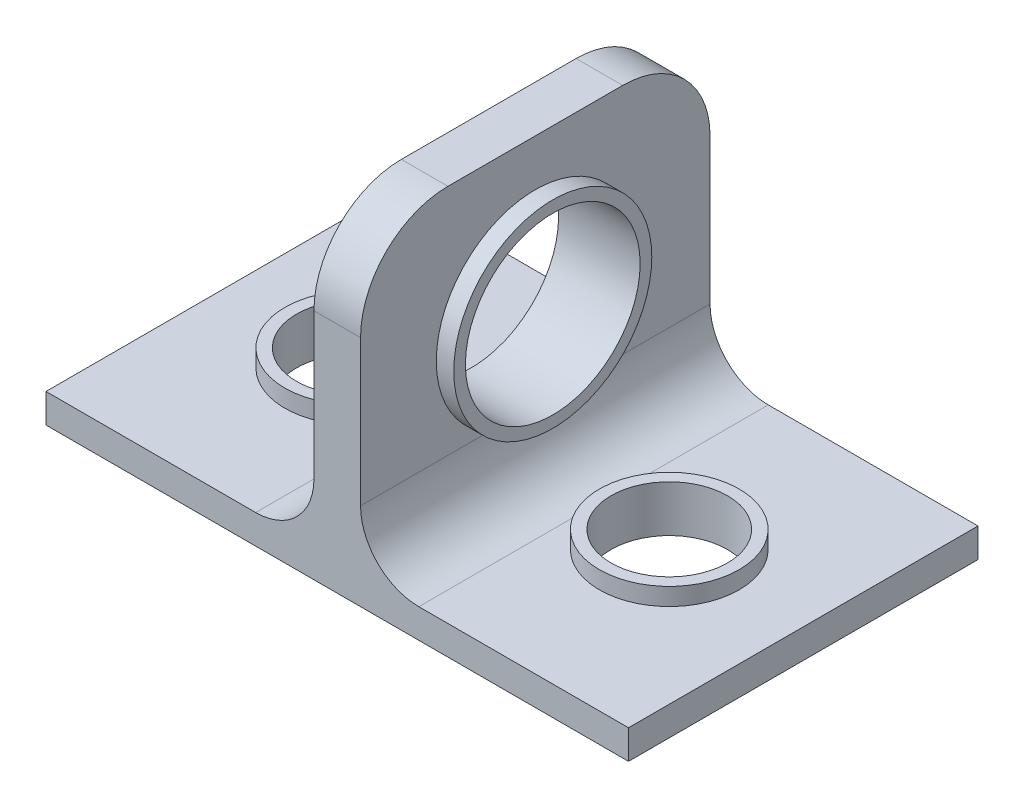
from build123d import *

# Parameters (mm, degrees)
BOSS_EXTRUDE1_DEPTH      = 30
FILLET1_R                = 10
CUT_EXTRUDE1_REACH       = 120.004
SKETCH2_R                = 10
SKETCH2_3_R              = 12
SKETCH2_3_R_2            = 10
BOSS_EXTRUDE2_DEPTH      = 8
CUT_EXTRUDE2_REACH       = 84.71
SKETCH3_R                = 15
BOSS_EXTRUDE3_DEPTH      = 3
BOSS_EXTRUDE3_DEPTH_BACK = 11
SKETCH3_3_R              = 17
SKETCH3_3_R_2            = 15
FILLET2_R                = 15


with BuildPart() as part:
    # Sketch1 → Boss-Extrude1 (new, symmetric)
    with BuildSketch(Plane.XY):
        Polygon((0, 0), (0, 5), (46, 5), (46, 55), (54, 55), (54, 5), (100, 5), (100, 0), align=None)
    extrude(amount=BOSS_EXTRUDE1_DEPTH, both=True)

    # Fillet1
    fillet1_edges = [part.edges().sort_by_distance(p)[0] for p in [
        (46, 5, 0),
        (54, 5, 0),
    ]]
    fillet(fillet1_edges, radius=FILLET1_R)

    # Sketch2 → Cut-Extrude1 (cut, up to next)
    with BuildSketch(Plane(origin=(0, 0, 0), x_dir=(1, 0, 0), z_dir=(0, 1, 0)), mode=Mode.PRIVATE) as cut_extrude1_sk1:
        with Locations((23, 0)):
            Circle(SKETCH2_R)
    cut_extrude1_tool1 = extrude(cut_extrude1_sk1.sketch, amount=CUT_EXTRUDE1_REACH, mode=Mode.PRIVATE) & part.part
    # Sketch2 → Cut-Extrude1 (cut, up to next)
    with BuildSketch(Plane(origin=(0, 0, 0), x_dir=(1, 0, 0), z_dir=(0, 1, 0)), mode=Mode.PRIVATE) as cut_extrude1_sk2:
        with Locations((77, 0)):
            Circle(SKETCH2_R)
    cut_extrude1_tool2 = extrude(cut_extrude1_sk2.sketch, amount=CUT_EXTRUDE1_REACH, mode=Mode.PRIVATE) & part.part
    add(cut_extrude1_tool1.solids().sort_by_distance((23, 0, 0))[0], mode=Mode.SUBTRACT)
    add(cut_extrude1_tool2.solids().sort_by_distance((77, 0, 0))[0], mode=Mode.SUBTRACT)

    # Sketch2<3> → Boss-Extrude2 (add)
    # profile 1 of 2: a face of its own
    with BuildSketch(Plane(origin=(0, 0, 0), x_dir=(1, 0, 0), z_dir=(0, 1, 0))):
        with Locations((23, 0)):
            Circle(SKETCH2_3_R)
        with Locations((23, 0)):
            Circle(SKETCH2_3_R_2, mode=Mode.SUBTRACT)
    # profile 2 of 2: a face of its own
    with BuildSketch(Plane(origin=(0, 0, 0), x_dir=(1, 0, 0), z_dir=(0, 1, 0))):
        with Locations((77, 0)):
            Circle(SKETCH2_3_R)
        with Locations((77, 0)):
            Circle(SKETCH2_3_R_2, mode=Mode.SUBTRACT)
    extrude(amount=BOSS_EXTRUDE2_DEPTH)

    # Sketch3 → Cut-Extrude2 (cut, up to next)
    with BuildSketch(Plane.ZY.offset(-46), mode=Mode.PRIVATE) as cut_extrude2_sk1:
        with Locations((0, 30)):
            Circle(SKETCH3_R)
    cut_extrude2_tool1 = extrude(cut_extrude2_sk1.sketch, amount=-CUT_EXTRUDE2_REACH, mode=Mode.PRIVATE) & part.part
    add(cut_extrude2_tool1.solids().sort_by_distance((46, 30, 0))[0], mode=Mode.SUBTRACT)

    # Sketch3<3> → Boss-Extrude3 (add, two sides: drawn at the far end of the back side and taken through both)
    with BuildSketch(Plane.ZY.offset(-46).offset(-BOSS_EXTRUDE3_DEPTH_BACK)):
        with Locations((0, 30)):
            Circle(SKETCH3_3_R)
        with Locations((0, 30)):
            Circle(SKETCH3_3_R_2, mode=Mode.SUBTRACT)
    extrude(amount=BOSS_EXTRUDE3_DEPTH + BOSS_EXTRUDE3_DEPTH_BACK)

    # Fillet2
    fillet2_edges = [part.edges().sort_by_distance(p)[0] for p in [
        (50, 55, -30),
        (50, 55, 30),
    ]]
    fillet(fillet2_edges, radius=FILLET2_R)


solid = part.part
